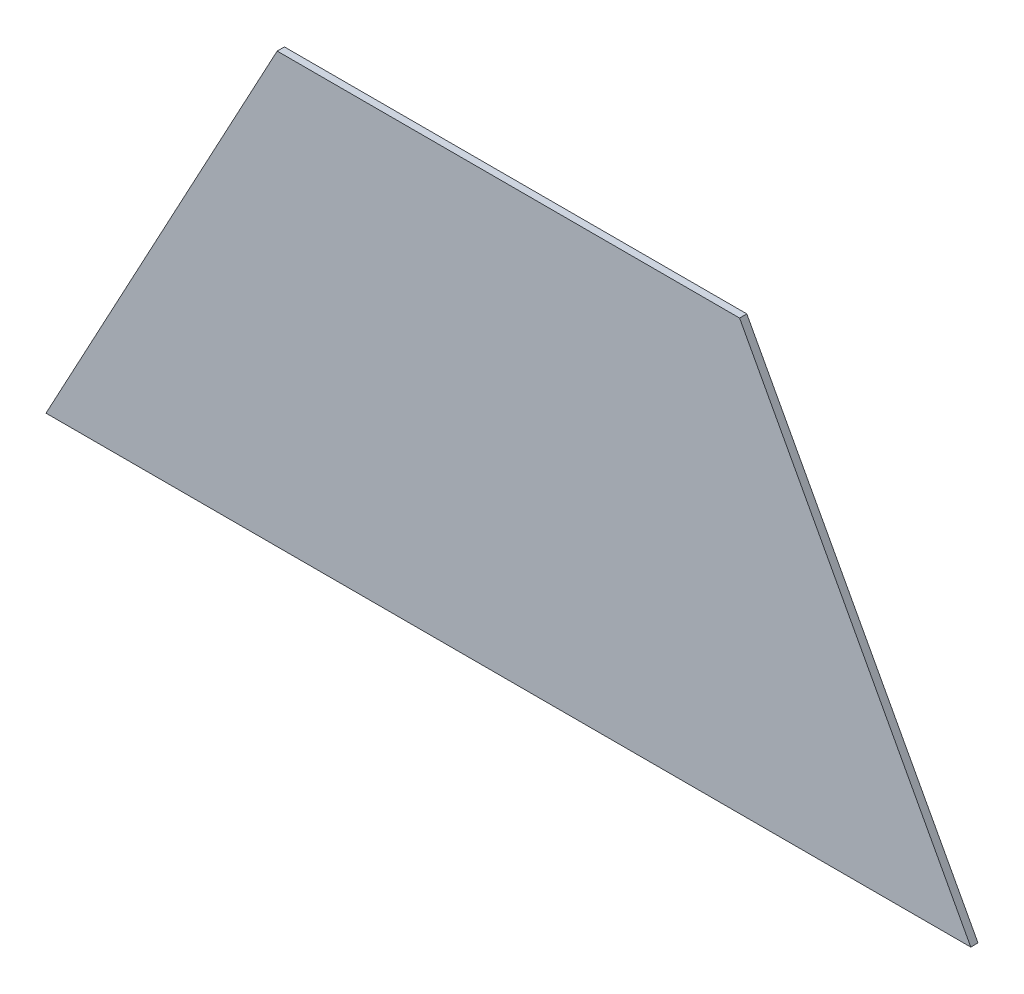
from build123d import *

# Parameters (mm, degrees)
EXTRUDE1_DEPTH = 1.5875


with BuildPart() as part:
    # Sketch1 → Extrude1 (new, symmetric)
    with BuildSketch(Plane.XY):
        Polygon((0, 0), (203.2, 0), (101.6, 188.614474199), (0, 188.614474199), (-101.6, 188.614474199), (-203.2, 0), align=None)
    extrude(amount=EXTRUDE1_DEPTH, both=True)


solid = part.part
